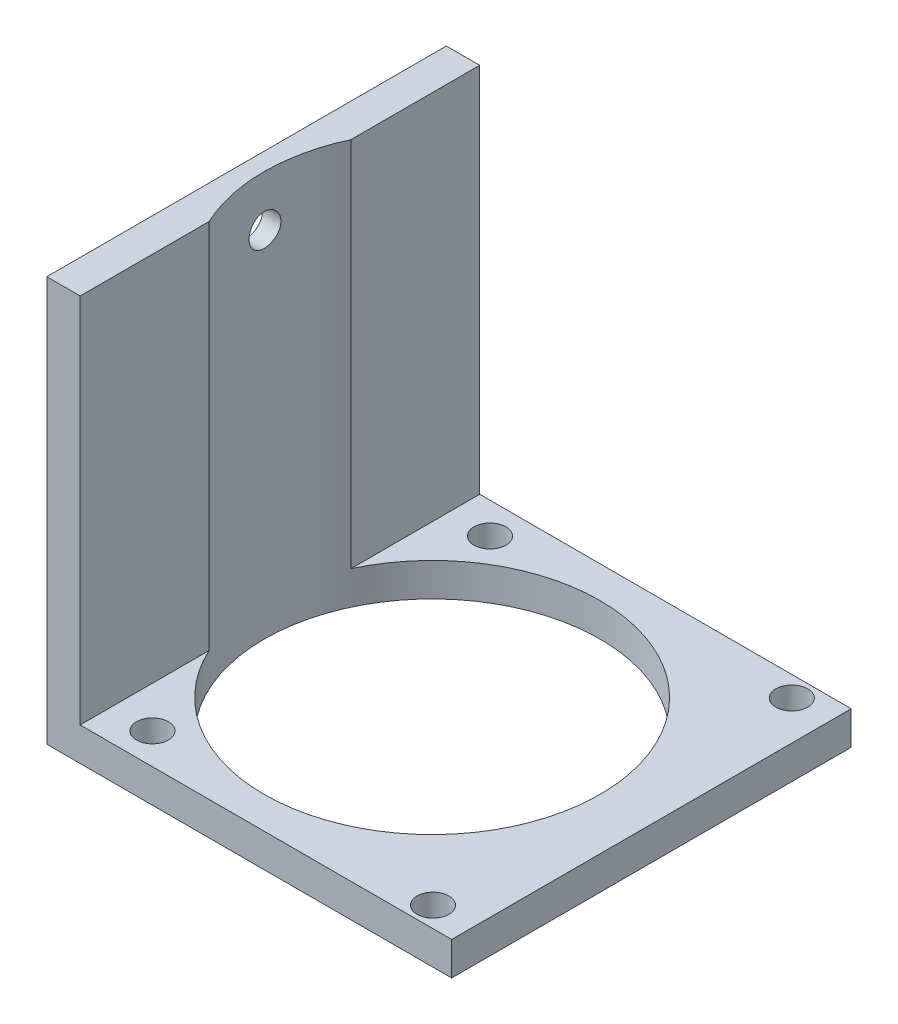
from build123d import *

# Parameters (mm, degrees)
EXTRUDE1_DEPTH          = 37.6
CUT_EXTRUDE1_DEPTH      = 64.934119217
CUT_EXTRUDE1_DEPTH_BACK = 64.934119217
SKETCH2_R               = 1.5
SKETCH2_R_2             = 15.8
SKETCH3_R               = 1.5
CUT_EXTRUDE2_DEPTH      = 66.703728966


with BuildPart() as part:
    # Sketch1 → Extrude1 (new body)
    with BuildSketch(Plane.XY):
        Polygon((0, 0), (38.1, 0), (38.1, 3.14), (3.14, 3.14), (3.14, 38.1), (0, 38.1), align=None)
    extrude(amount=EXTRUDE1_DEPTH)

    # Sketch2 → Cut-Extrude1 (cut, two sides: drawn at the far end of the back side and taken through both)
    with BuildSketch(Plane(origin=(0, 3.14, 0), x_dir=(-1, 0, 0), z_dir=(0, 1, 0)).offset(-CUT_EXTRUDE1_DEPTH_BACK)):
        with Locations((-34.425, 35.68)):
            Circle(SKETCH2_R)
        with Locations((-17.4625, 18.8)):
            Circle(SKETCH2_R_2)
        with Locations((-34.425, 1.92)):
            Circle(SKETCH2_R)
        with Locations((-7.025, 34.68)):
            Circle(SKETCH2_R)
        with Locations((-7.025, 2.92)):
            Circle(SKETCH2_R)
    extrude(amount=CUT_EXTRUDE1_DEPTH + CUT_EXTRUDE1_DEPTH_BACK, mode=Mode.SUBTRACT)

    # Sketch3 → Cut-Extrude2 (cut, through all)
    with BuildSketch(Plane.ZY):
        with Locations((18.8, 33.3375)):
            Circle(SKETCH3_R)
    extrude(amount=-CUT_EXTRUDE2_DEPTH, mode=Mode.SUBTRACT)


solid = part.part
